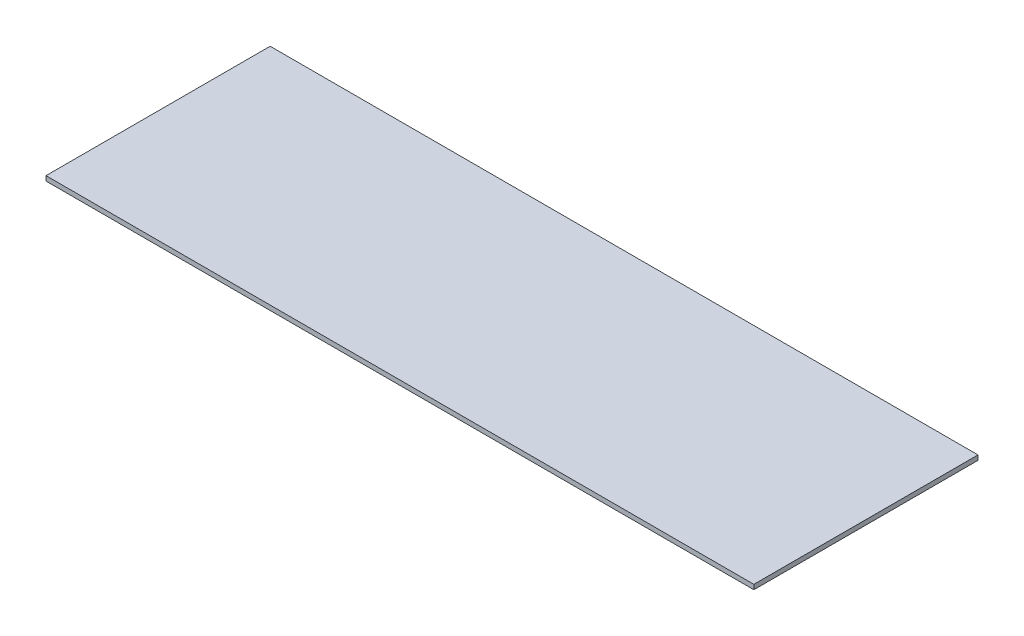
from build123d import *

# Parameters (mm, degrees)
SKETCH1_W           = 190.5
SKETCH1_H           = 60.325
BOSS_EXTRUDE1_DEPTH = 1.27


with BuildPart() as part:
    # Sketch1 → Boss-Extrude1 (new body)
    with BuildSketch(Plane(origin=(0, 0, 0), x_dir=(1, 0, 0), z_dir=(0, 1, 0))):
        with Locations((95.25, 30.1625)):
            Rectangle(SKETCH1_W, SKETCH1_H)
    extrude(amount=BOSS_EXTRUDE1_DEPTH)


solid = part.part
